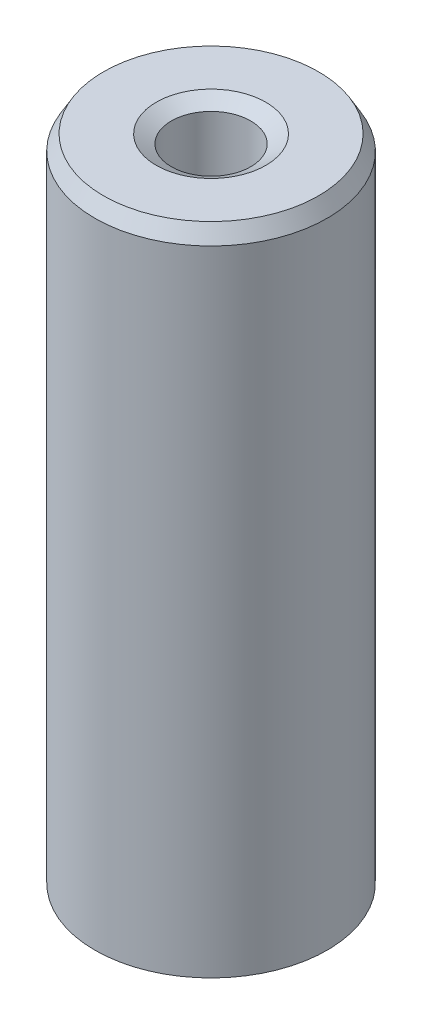
from build123d import *
from OCP.BRepFilletAPI import BRepFilletAPI_MakeChamfer

# Parameters (mm, degrees)
SKETCH1_R           = 12.5
BOSS_EXTRUDE1_DEPTH = 70.737820238
SKETCH2_R           = 4.271787909
CUT_EXTRUDE1_DEPTH  = 73.913230706
CHAMFER1_SIZE       = 1.61960177
CHAMFER1_SIZE2      = 0.935077518


with BuildPart() as part:
    # Sketch1 → Boss-Extrude1 (new body)
    with BuildSketch(Plane(origin=(0, 0, 0), x_dir=(1, 0, 0), z_dir=(0, 1, 0))):
        Circle(SKETCH1_R)
    extrude(amount=BOSS_EXTRUDE1_DEPTH)

    # Sketch2 → Cut-Extrude1 (cut, through all)
    with BuildSketch(Plane(origin=(0, 0, 0), x_dir=(1, 0, 0), z_dir=(0, 1, 0))):
        Circle(SKETCH2_R)
    extrude(amount=CUT_EXTRUDE1_DEPTH, mode=Mode.SUBTRACT)

    # Chamfer1: one chamfer whose edges measure the first distance from different faces: ONE call of the kernel's chamfer builder (chamfer() names one face for all edges)
    chamfer1_edges_1 = [part.edges().sort_by_distance(p)[0] for p in [
        (-4.271787909, 70.737820238, 0),
    ]]
    chamfer1_side_1 = [part.faces().sort_by_distance(p)[0] for p in [
        (-12.146446609, 70.737820238, 0),
    ]]
    chamfer1_edges_2 = [part.edges().sort_by_distance(p)[0] for p in [
        (-4.271787909, 0, 0),
    ]]
    chamfer1_side_2 = [part.faces().sort_by_distance(p)[0] for p in [
        (-4.271787909, 35.368910119, 0),
    ]]
    chamfer1_edges_3 = [part.edges().sort_by_distance(p)[0] for p in [
        (-12.5, 0, 0),
    ]]
    chamfer1_side_3 = [part.faces().sort_by_distance(p)[0] for p in [
        (-12.146446609, 0, 0),
    ]]
    chamfer1_edges_4 = [part.edges().sort_by_distance(p)[0] for p in [
        (-12.5, 70.737820238, 0),
    ]]
    chamfer1_side_4 = [part.faces().sort_by_distance(p)[0] for p in [
        (-12.5, 35.368910119, 0),
    ]]
    chamfer1 = BRepFilletAPI_MakeChamfer(part.part.solid().wrapped)
    for e in chamfer1_edges_1:
        chamfer1.Add(CHAMFER1_SIZE, CHAMFER1_SIZE2, e.wrapped, chamfer1_side_1[0].wrapped)  # the first distance lies on this face
    for e in chamfer1_edges_2:
        chamfer1.Add(CHAMFER1_SIZE, CHAMFER1_SIZE2, e.wrapped, chamfer1_side_2[0].wrapped)  # the first distance lies on this face
    for e in chamfer1_edges_3:
        chamfer1.Add(CHAMFER1_SIZE, CHAMFER1_SIZE2, e.wrapped, chamfer1_side_3[0].wrapped)  # the first distance lies on this face
    for e in chamfer1_edges_4:
        chamfer1.Add(CHAMFER1_SIZE, CHAMFER1_SIZE2, e.wrapped, chamfer1_side_4[0].wrapped)  # the first distance lies on this face
    add(Compound.cast(chamfer1.Shape()), mode=Mode.REPLACE)


solid = part.part
